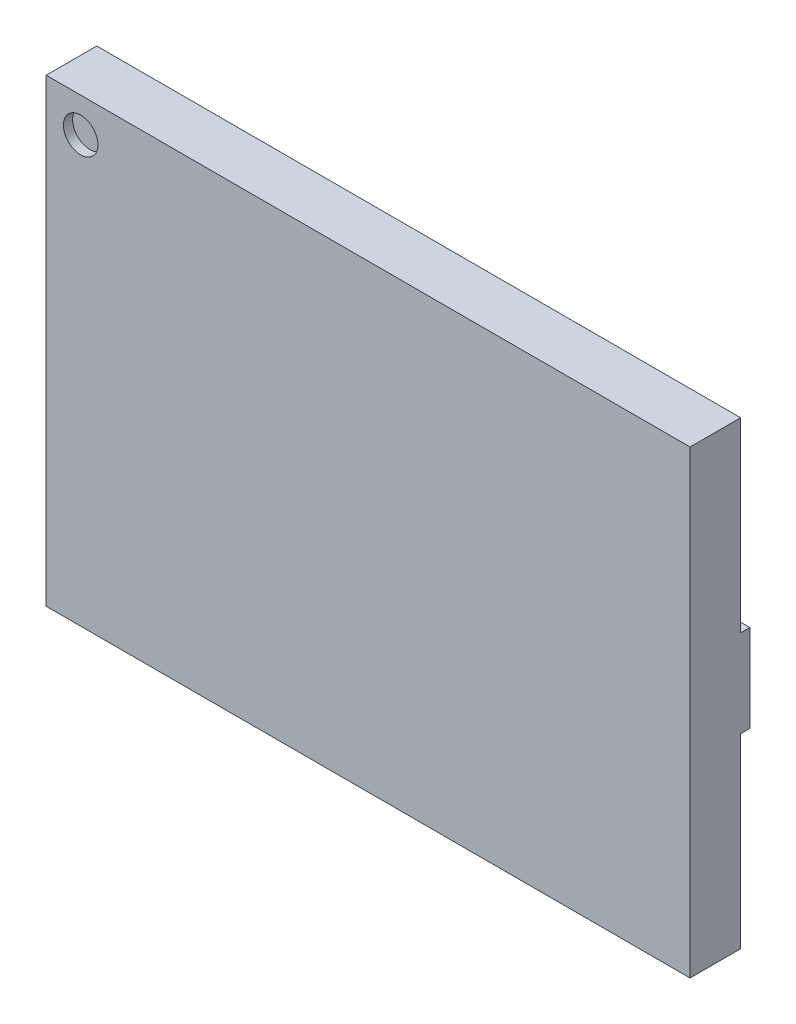
from build123d import *

# Parameters (mm, degrees)
SKETCH1_W           = 14
SKETCH1_H           = 10
BOSS_EXTRUDE1_DEPTH = 1.1
SKETCH2_W           = 14
SKETCH2_H           = 1.9
BOSS_EXTRUDE2_DEPTH = 0.2
SKETCH4_R           = 0.25
BOSS_EXTRUDE3_DEPTH = 0.2
SKETCH7_R           = 0.375
CUT_EXTRUDE1_DEPTH  = 0.2


with BuildPart() as part:
    # Sketch1 → Boss-Extrude1 (new body)
    with BuildSketch(Plane.XY):
        with Locations((0.087404222, 1.9415128)):
            Rectangle(SKETCH1_W, SKETCH1_H)
    extrude(amount=BOSS_EXTRUDE1_DEPTH)

    # Sketch2 → Boss-Extrude2 (add)
    with BuildSketch(Plane(origin=(0, 0, 0), x_dir=(-1, 0, 0), z_dir=(0, 0, -1))):
        with Locations((-0.087404222, 1.9415128)):
            Rectangle(SKETCH2_W, SKETCH2_H)
    extrude(amount=BOSS_EXTRUDE2_DEPTH)

    # Sketch4 → Boss-Extrude3 (add)
    with BuildSketch(Plane(origin=(0, 0, 0), x_dir=(-1, 0, 0), z_dir=(0, 0, -1))):
        with Locations((-0.087404222, 6.3415128)):
            Circle(SKETCH4_R)
        with Locations((-0.087404222, 3.9415128)):
            Circle(SKETCH4_R)
        with Locations((-0.087404222, 4.7415128)):
            Circle(SKETCH4_R)
        with Locations((-0.087404222, 5.5415128)):
            Circle(SKETCH4_R)
        with Locations((-6.487404222, 3.9415128)):
            Circle(SKETCH4_R)
        with Locations((-6.487404222, -0.0584872)):
            Circle(SKETCH4_R)
        with Locations((-5.687404222, 3.9415128)):
            Circle(SKETCH4_R)
        with Locations((-4.887404222, 3.9415128)):
            Circle(SKETCH4_R)
        with Locations((-4.087404222, 3.9415128)):
            Circle(SKETCH4_R)
        with Locations((-3.287404222, 3.9415128)):
            Circle(SKETCH4_R)
        with Locations((-2.487404222, 3.9415128)):
            Circle(SKETCH4_R)
        with Locations((-1.687404222, 3.9415128)):
            Circle(SKETCH4_R)
        with Locations((-0.887404222, 3.9415128)):
            Circle(SKETCH4_R)
        with Locations((0.712595778, 3.9415128)):
            Circle(SKETCH4_R)
        with Locations((1.512595778, 3.9415128)):
            Circle(SKETCH4_R)
        with Locations((2.312595778, 3.9415128)):
            Circle(SKETCH4_R)
        with Locations((3.112595778, 3.9415128)):
            Circle(SKETCH4_R)
        with Locations((3.912595778, 3.9415128)):
            Circle(SKETCH4_R)
        with Locations((4.712595778, 3.9415128)):
            Circle(SKETCH4_R)
        with Locations((5.512595778, 3.9415128)):
            Circle(SKETCH4_R)
        with Locations((6.312595778, 3.9415128)):
            Circle(SKETCH4_R)
        with Locations((-5.687404222, 4.7415128)):
            Circle(SKETCH4_R)
        with Locations((-4.887404222, 4.7415128)):
            Circle(SKETCH4_R)
        with Locations((-4.087404222, 4.7415128)):
            Circle(SKETCH4_R)
        with Locations((-3.287404222, 4.7415128)):
            Circle(SKETCH4_R)
        with Locations((-2.487404222, 4.7415128)):
            Circle(SKETCH4_R)
        with Locations((-1.687404222, 4.7415128)):
            Circle(SKETCH4_R)
        with Locations((-0.887404222, 4.7415128)):
            Circle(SKETCH4_R)
        with Locations((0.712595778, 4.7415128)):
            Circle(SKETCH4_R)
        with Locations((1.512595778, 4.7415128)):
            Circle(SKETCH4_R)
        with Locations((2.312595778, 4.7415128)):
            Circle(SKETCH4_R)
        with Locations((3.112595778, 4.7415128)):
            Circle(SKETCH4_R)
        with Locations((3.912595778, 4.7415128)):
            Circle(SKETCH4_R)
        with Locations((4.712595778, 4.7415128)):
            Circle(SKETCH4_R)
        with Locations((5.512595778, 4.7415128)):
            Circle(SKETCH4_R)
        with Locations((6.312595778, 4.7415128)):
            Circle(SKETCH4_R)
        with Locations((-5.687404222, 5.5415128)):
            Circle(SKETCH4_R)
        with Locations((-4.887404222, 5.5415128)):
            Circle(SKETCH4_R)
        with Locations((-4.087404222, 5.5415128)):
            Circle(SKETCH4_R)
        with Locations((-3.287404222, 5.5415128)):
            Circle(SKETCH4_R)
        with Locations((-2.487404222, 5.5415128)):
            Circle(SKETCH4_R)
        with Locations((-1.687404222, 5.5415128)):
            Circle(SKETCH4_R)
        with Locations((-0.887404222, 5.5415128)):
            Circle(SKETCH4_R)
        with Locations((0.712595778, 5.5415128)):
            Circle(SKETCH4_R)
        with Locations((1.512595778, 5.5415128)):
            Circle(SKETCH4_R)
        with Locations((2.312595778, 5.5415128)):
            Circle(SKETCH4_R)
        with Locations((3.112595778, 5.5415128)):
            Circle(SKETCH4_R)
        with Locations((3.912595778, 5.5415128)):
            Circle(SKETCH4_R)
        with Locations((4.712595778, 5.5415128)):
            Circle(SKETCH4_R)
        with Locations((5.512595778, 5.5415128)):
            Circle(SKETCH4_R)
        with Locations((6.312595778, 5.5415128)):
            Circle(SKETCH4_R)
        with Locations((-5.687404222, 6.3415128)):
            Circle(SKETCH4_R)
        with Locations((-4.887404222, 6.3415128)):
            Circle(SKETCH4_R)
        with Locations((-4.087404222, 6.3415128)):
            Circle(SKETCH4_R)
        with Locations((-3.287404222, 6.3415128)):
            Circle(SKETCH4_R)
        with Locations((-2.487404222, 6.3415128)):
            Circle(SKETCH4_R)
        with Locations((-1.687404222, 6.3415128)):
            Circle(SKETCH4_R)
        with Locations((-0.887404222, 6.3415128)):
            Circle(SKETCH4_R)
        with Locations((0.712595778, 6.3415128)):
            Circle(SKETCH4_R)
        with Locations((1.512595778, 6.3415128)):
            Circle(SKETCH4_R)
        with Locations((2.312595778, 6.3415128)):
            Circle(SKETCH4_R)
        with Locations((3.112595778, 6.3415128)):
            Circle(SKETCH4_R)
        with Locations((3.912595778, 6.3415128)):
            Circle(SKETCH4_R)
        with Locations((4.712595778, 6.3415128)):
            Circle(SKETCH4_R)
        with Locations((5.512595778, 6.3415128)):
            Circle(SKETCH4_R)
        with Locations((6.312595778, 6.3415128)):
            Circle(SKETCH4_R)
        with Locations((-6.487404222, 4.7415128)):
            Circle(SKETCH4_R)
        with Locations((-6.487404222, 5.5415128)):
            Circle(SKETCH4_R)
        with Locations((-6.487404222, 6.3415128)):
            Circle(SKETCH4_R)
        with Locations((-5.687404222, -0.0584872)):
            Circle(SKETCH4_R)
        with Locations((-4.887404222, -0.0584872)):
            Circle(SKETCH4_R)
        with Locations((-4.087404222, -0.0584872)):
            Circle(SKETCH4_R)
        with Locations((-3.287404222, -0.0584872)):
            Circle(SKETCH4_R)
        with Locations((-2.487404222, -0.0584872)):
            Circle(SKETCH4_R)
        with Locations((-1.687404222, -0.0584872)):
            Circle(SKETCH4_R)
        with Locations((-0.887404222, -0.0584872)):
            Circle(SKETCH4_R)
        with Locations((-0.087404222, -0.0584872)):
            Circle(SKETCH4_R)
        with Locations((0.712595778, -0.0584872)):
            Circle(SKETCH4_R)
        with Locations((1.512595778, -0.0584872)):
            Circle(SKETCH4_R)
        with Locations((2.312595778, -0.0584872)):
            Circle(SKETCH4_R)
        with Locations((3.112595778, -0.0584872)):
            Circle(SKETCH4_R)
        with Locations((3.912595778, -0.0584872)):
            Circle(SKETCH4_R)
        with Locations((4.712595778, -0.0584872)):
            Circle(SKETCH4_R)
        with Locations((5.512595778, -0.0584872)):
            Circle(SKETCH4_R)
        with Locations((6.312595778, -0.0584872)):
            Circle(SKETCH4_R)
        with Locations((-5.687404222, -0.8584872)):
            Circle(SKETCH4_R)
        with Locations((-4.887404222, -0.8584872)):
            Circle(SKETCH4_R)
        with Locations((-4.087404222, -0.8584872)):
            Circle(SKETCH4_R)
        with Locations((-3.287404222, -0.8584872)):
            Circle(SKETCH4_R)
        with Locations((-2.487404222, -0.8584872)):
            Circle(SKETCH4_R)
        with Locations((-1.687404222, -0.8584872)):
            Circle(SKETCH4_R)
        with Locations((-0.887404222, -0.8584872)):
            Circle(SKETCH4_R)
        with Locations((-0.087404222, -0.8584872)):
            Circle(SKETCH4_R)
        with Locations((0.712595778, -0.8584872)):
            Circle(SKETCH4_R)
        with Locations((1.512595778, -0.8584872)):
            Circle(SKETCH4_R)
        with Locations((2.312595778, -0.8584872)):
            Circle(SKETCH4_R)
        with Locations((3.112595778, -0.8584872)):
            Circle(SKETCH4_R)
        with Locations((3.912595778, -0.8584872)):
            Circle(SKETCH4_R)
        with Locations((4.712595778, -0.8584872)):
            Circle(SKETCH4_R)
        with Locations((5.512595778, -0.8584872)):
            Circle(SKETCH4_R)
        with Locations((6.312595778, -0.8584872)):
            Circle(SKETCH4_R)
        with Locations((-5.687404222, -1.6584872)):
            Circle(SKETCH4_R)
        with Locations((-4.887404222, -1.6584872)):
            Circle(SKETCH4_R)
        with Locations((-4.087404222, -1.6584872)):
            Circle(SKETCH4_R)
        with Locations((-3.287404222, -1.6584872)):
            Circle(SKETCH4_R)
        with Locations((-2.487404222, -1.6584872)):
            Circle(SKETCH4_R)
        with Locations((-1.687404222, -1.6584872)):
            Circle(SKETCH4_R)
        with Locations((-0.887404222, -1.6584872)):
            Circle(SKETCH4_R)
        with Locations((-0.087404222, -1.6584872)):
            Circle(SKETCH4_R)
        with Locations((0.712595778, -1.6584872)):
            Circle(SKETCH4_R)
        with Locations((1.512595778, -1.6584872)):
            Circle(SKETCH4_R)
        with Locations((2.312595778, -1.6584872)):
            Circle(SKETCH4_R)
        with Locations((3.112595778, -1.6584872)):
            Circle(SKETCH4_R)
        with Locations((3.912595778, -1.6584872)):
            Circle(SKETCH4_R)
        with Locations((4.712595778, -1.6584872)):
            Circle(SKETCH4_R)
        with Locations((5.512595778, -1.6584872)):
            Circle(SKETCH4_R)
        with Locations((6.312595778, -1.6584872)):
            Circle(SKETCH4_R)
        with Locations((-5.687404222, -2.4584872)):
            Circle(SKETCH4_R)
        with Locations((-4.887404222, -2.4584872)):
            Circle(SKETCH4_R)
        with Locations((-4.087404222, -2.4584872)):
            Circle(SKETCH4_R)
        with Locations((-3.287404222, -2.4584872)):
            Circle(SKETCH4_R)
        with Locations((-2.487404222, -2.4584872)):
            Circle(SKETCH4_R)
        with Locations((-1.687404222, -2.4584872)):
            Circle(SKETCH4_R)
        with Locations((-0.887404222, -2.4584872)):
            Circle(SKETCH4_R)
        with Locations((-0.087404222, -2.4584872)):
            Circle(SKETCH4_R)
        with Locations((0.712595778, -2.4584872)):
            Circle(SKETCH4_R)
        with Locations((1.512595778, -2.4584872)):
            Circle(SKETCH4_R)
        with Locations((2.312595778, -2.4584872)):
            Circle(SKETCH4_R)
        with Locations((3.112595778, -2.4584872)):
            Circle(SKETCH4_R)
        with Locations((3.912595778, -2.4584872)):
            Circle(SKETCH4_R)
        with Locations((4.712595778, -2.4584872)):
            Circle(SKETCH4_R)
        with Locations((5.512595778, -2.4584872)):
            Circle(SKETCH4_R)
        with Locations((6.312595778, -2.4584872)):
            Circle(SKETCH4_R)
        with Locations((-6.487404222, -0.8584872)):
            Circle(SKETCH4_R)
        with Locations((-6.487404222, -1.6584872)):
            Circle(SKETCH4_R)
        with Locations((-6.487404222, -2.4584872)):
            Circle(SKETCH4_R)
    extrude(amount=BOSS_EXTRUDE3_DEPTH)

    # Sketch7 → Cut-Extrude1 (cut)
    with BuildSketch(Plane.XY.offset(1.1)):
        with Locations((-6.162595778, 6.1915128)):
            Circle(SKETCH7_R)
    extrude(amount=-CUT_EXTRUDE1_DEPTH, mode=Mode.SUBTRACT)


solid = part.part
